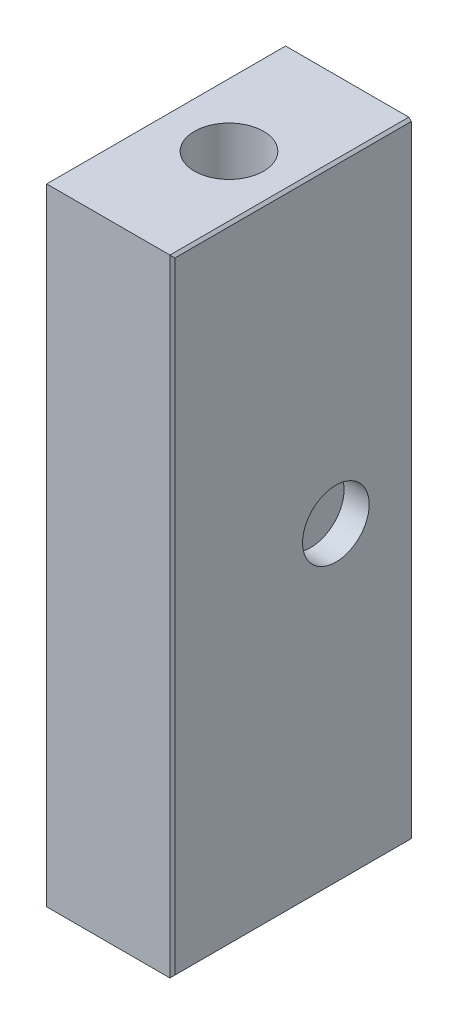
from build123d import *

# Parameters (mm, degrees)
SKETCH1_W           = 10
SKETCH1_H           = 19
SKETCH1_R           = 2.75
BOSS_EXTRUDE1_DEPTH = 24.9
SKETCH2_R           = 2.65
CUT_EXTRUDE1_DEPTH  = 2
CHAMFER1_SIZE       = 0.2


with BuildPart() as part:
    # Sketch1 → Boss-Extrude1 (new, symmetric)
    with BuildSketch(Plane(origin=(0, 0, 0), x_dir=(1, 0, 0), z_dir=(0, 1, 0))):
        Rectangle(SKETCH1_W, SKETCH1_H)
        Circle(SKETCH1_R, mode=Mode.SUBTRACT)
    extrude(amount=BOSS_EXTRUDE1_DEPTH, both=True)

    # Sketch2 → Cut-Extrude1 (cut)
    with BuildSketch(Plane(origin=(5, 0, 0), x_dir=(0, 0, -1), z_dir=(1, 0, 0))):
        with Locations((3.5, 0)):
            Circle(SKETCH2_R)
    extrude(amount=-CUT_EXTRUDE1_DEPTH, mode=Mode.SUBTRACT)

    # Chamfer1
    chamfer1_edges = [part.edges().sort_by_distance(p)[0] for p in [
        (5, -24.9, 0),
        (5, 0, 9.5),
        (5, 24.9, 0),
    ]]
    chamfer(chamfer1_edges, length=CHAMFER1_SIZE)


solid = part.part
